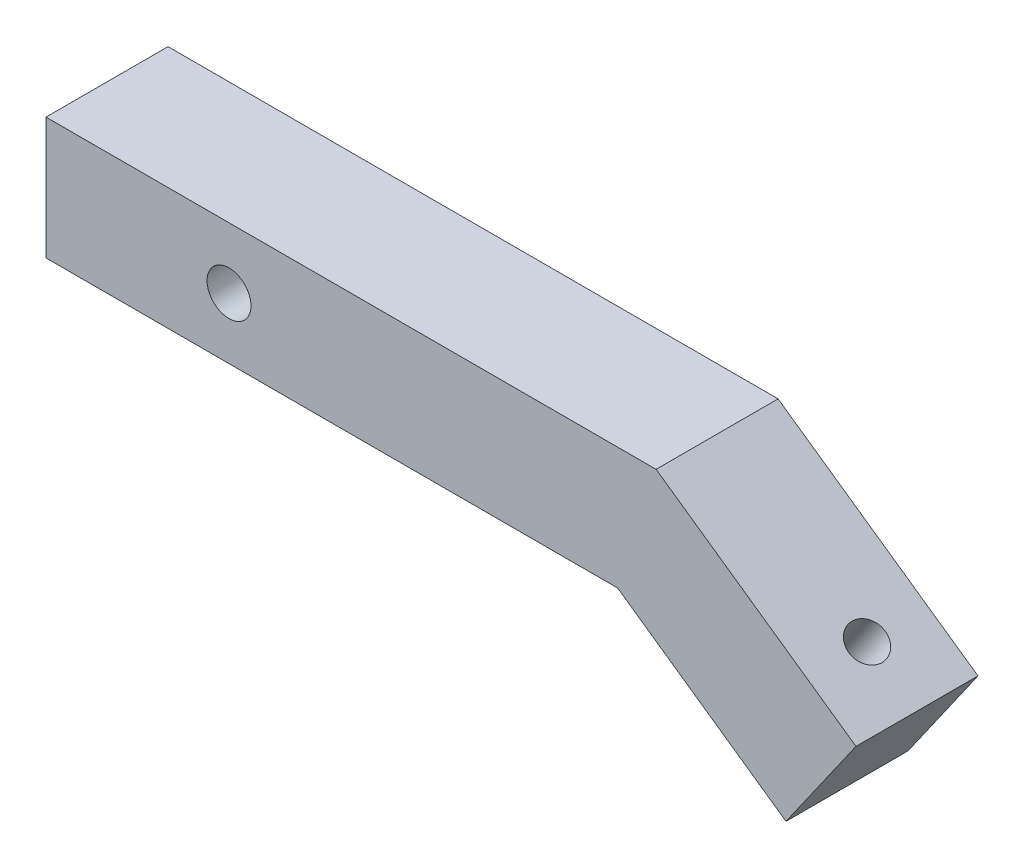
from build123d import *

# Parameters (mm, degrees)
BOSS_EXTRUDE1_DEPTH = 12.7
SKETCH2_R           = 2.286
CUT_EXTRUDE1_DEPTH  = 12.7
SKETCH3_R           = 1.905
CUT_EXTRUDE2_DEPTH  = 12.7


with BuildPart() as part:
    # Sketch1 → Boss-Extrude1 (new body)
    with BuildSketch(Plane.XY):
        Polygon((0, 0), (63.5, 0), (84.306461925, -14.568841483), (77.022041183, -24.972072446), (59.495705381, -12.7), (0, -12.7), align=None)
    extrude(amount=BOSS_EXTRUDE1_DEPTH)

    # Sketch2 → Cut-Extrude1 (cut)
    with BuildSketch(Plane(origin=(0, 0, 0), x_dir=(-1, 0, 0), z_dir=(0, 0, -1))):
        with Locations((-19.05, -6.35)):
            Circle(SKETCH2_R)
    extrude(amount=-CUT_EXTRUDE1_DEPTH, mode=Mode.SUBTRACT)

    # Sketch3 → Cut-Extrude2 (cut)
    with BuildSketch(Plane(origin=(13.606439708, 19.432009747, 0), x_dir=(0.8191520442889908, -0.5735764363510476, 0), z_dir=(-0.5735764363510476, -0.8191520442889909, 0))):
        with Locations((71.066154812, 6.35)):
            Circle(SKETCH3_R)
    extrude(amount=-CUT_EXTRUDE2_DEPTH, mode=Mode.SUBTRACT)


solid = part.part
